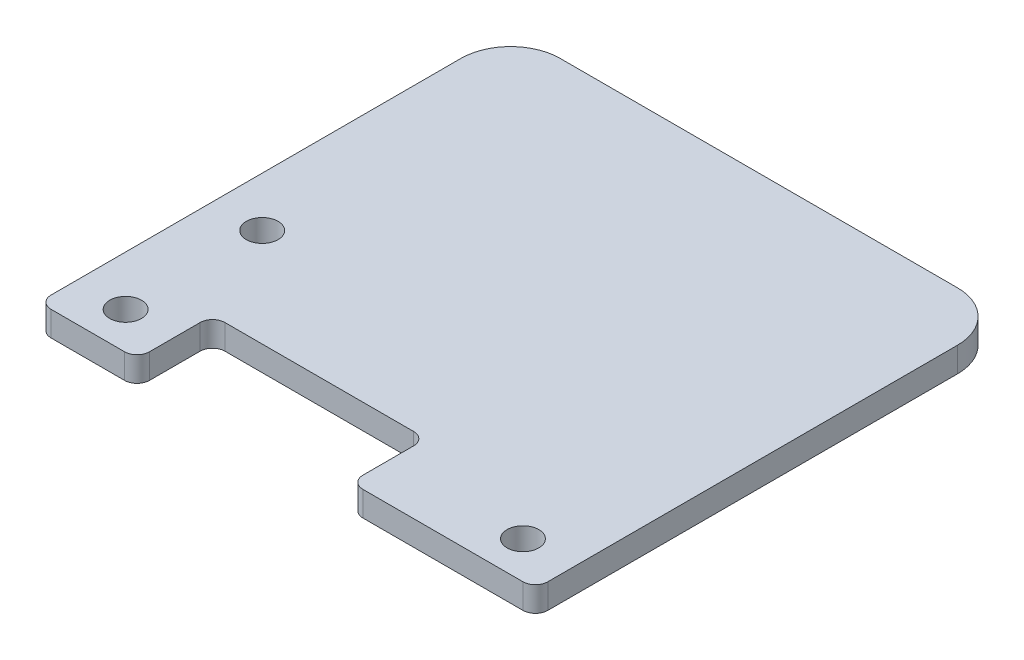
from build123d import *

# Parameters (mm, degrees)
SKETCH1_W           = 63.5
SKETCH1_H           = 60.325
BOSS_EXTRUDE1_DEPTH = 3.175
SKETCH2_R           = 2.032
CUT_EXTRUDE1_DEPTH  = 44.908080478
SKETCH3_W           = 27.305
SKETCH3_H           = 9.652
CUT_EXTRUDE2_DEPTH  = 44.908080478
FILLET1_R           = 1.5875
FILLET2_R           = 6.35
SKETCH4_R           = 2.032
CUT_EXTRUDE3_DEPTH  = 44.908080478


with BuildPart() as part:
    # Sketch1 → Boss-Extrude1 (new body)
    with BuildSketch(Plane(origin=(0, 0, 0), x_dir=(1, 0, 0), z_dir=(0, 1, 0))):
        Rectangle(SKETCH1_W, SKETCH1_H)
    extrude(amount=BOSS_EXTRUDE1_DEPTH)

    # Sketch2 → Cut-Extrude1 (cut, through all)
    with BuildSketch(Plane(origin=(0, 0, 0), x_dir=(-1, 0, 0), z_dir=(0, -1, 0))):
        with Locations((-25.4, -25.4)):
            Circle(SKETCH2_R)
        with Locations((25.4, -25.4)):
            Circle(SKETCH2_R)
    extrude(amount=-CUT_EXTRUDE1_DEPTH, mode=Mode.SUBTRACT)

    # Sketch3 → Cut-Extrude2 (cut, through all)
    with BuildSketch(Plane(origin=(0, 3.175, 0), x_dir=(1, 0, 0), z_dir=(0, 1, 0))):
        with Locations((-5.5245, -25.3365)):
            Rectangle(SKETCH3_W, SKETCH3_H)
    extrude(amount=-CUT_EXTRUDE2_DEPTH, mode=Mode.SUBTRACT)

    # Fillet1
    fillet1_edges = [part.edges().sort_by_distance(p)[0] for p in [
        (-31.75, 1.5875, 30.1625),
        (-19.177, 1.5875, 30.1625),
        (-19.177, 1.5875, 20.5105),
        (8.128, 1.5875, 20.5105),
        (8.128, 1.5875, 30.1625),
        (31.75, 1.5875, 30.1625),
    ]]
    fillet(fillet1_edges, radius=FILLET1_R)

    # Fillet2
    fillet2_edges = [part.edges().sort_by_distance(p)[0] for p in [
        (-31.75, 1.5875, -30.1625),
        (31.75, 1.5875, -30.1625),
    ]]
    fillet(fillet2_edges, radius=FILLET2_R)

    # Sketch4 → Cut-Extrude3 (cut, through all)
    with BuildSketch(Plane(origin=(0, 3.175, 0), x_dir=(1, 0, 0), z_dir=(0, 1, 0))):
        with Locations((-25.4, -7.9375)):
            Circle(SKETCH4_R)
    extrude(amount=-CUT_EXTRUDE3_DEPTH, mode=Mode.SUBTRACT)


solid = part.part
